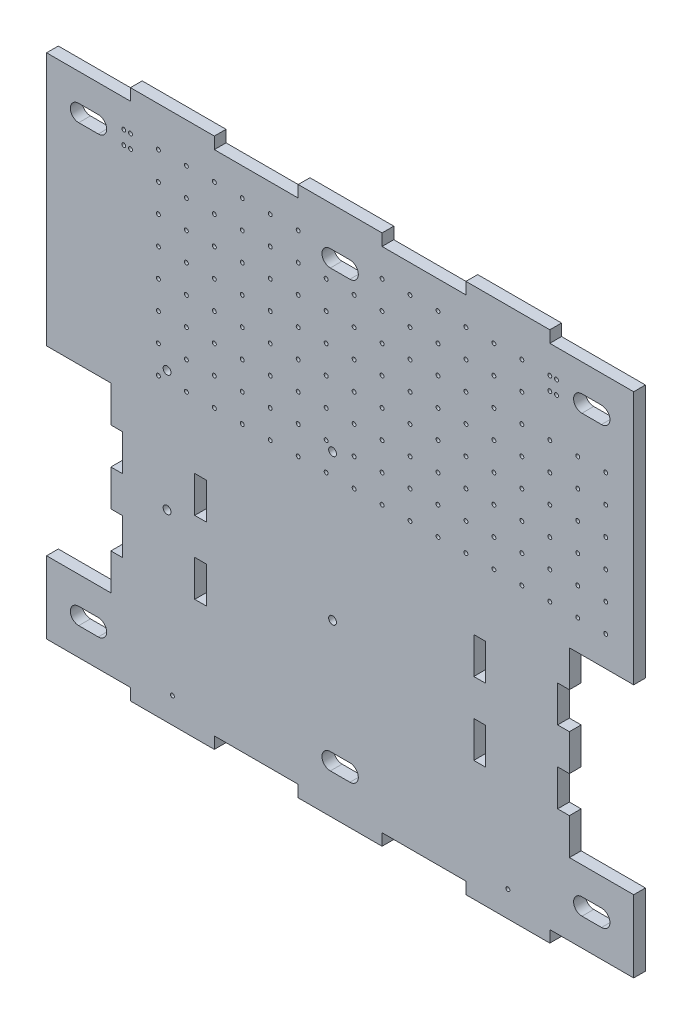
from build123d import *

# Parameters (mm, degrees)
SKETCH1_W           = 266.7
SKETCH1_H           = 241.3
BOSS_EXTRUDE1_DEPTH = 5.334
SKETCH2_W           = 29.21
SKETCH2_H           = 82.55
CUT_EXTRUDE1_DEPTH  = 180.908578328
SKETCH9_W           = 5.334
SKETCH9_H           = 16.51
CUT_EXTRUDE2_DEPTH  = 180.908578328
SKETCH23_W          = 5.334
SKETCH23_H          = 16.51
CUT_EXTRUDE8_DEPTH  = 180.908578328
SKETCH28_W          = 38.1
SKETCH28_H          = 5.334
CUT_EXTRUDE13_DEPTH = 180.908578328
SKETCH29_W          = 38.1
SKETCH29_H          = 5.334
CUT_EXTRUDE14_DEPTH = 180.908578328
SKETCH30_R          = 0.889
CUT_EXTRUDE15_DEPTH = 180.908578328
SKETCH32_R          = 1.778
CUT_EXTRUDE16_DEPTH = 180.908578328
CUT_EXTRUDE19_DEPTH = 180.908578328
SKETCH36_R          = 0.889
CUT_EXTRUDE20_DEPTH = 180.908578328


with BuildPart() as part:
    # Sketch1 → Boss-Extrude1 (new body)
    with BuildSketch(Plane.XY):
        Rectangle(SKETCH1_W, SKETCH1_H)
    extrude(amount=BOSS_EXTRUDE1_DEPTH)

    # Sketch2 → Cut-Extrude1 (cut, through all)
    with BuildSketch(Plane(origin=(0, 0, 0), x_dir=(-1, 0, 0), z_dir=(0, 0, -1))):
        with Locations((118.745, -41.275)):
            Rectangle(SKETCH2_W, SKETCH2_H)
        with Locations((-118.745, -41.275)):
            Rectangle(SKETCH2_W, SKETCH2_H)
    extrude(amount=-CUT_EXTRUDE1_DEPTH, mode=Mode.SUBTRACT)

    # Sketch9 → Cut-Extrude2 (cut, through all)
    with BuildSketch(Plane.XY.offset(5.334)):
        with Locations((-101.473, -24.765)):
            Rectangle(SKETCH9_W, SKETCH9_H)
        with Locations((-101.473, -57.785)):
            Rectangle(SKETCH9_W, SKETCH9_H)
        with Locations((101.473, -57.785)):
            Rectangle(SKETCH9_W, SKETCH9_H)
        with Locations((101.473, -24.765)):
            Rectangle(SKETCH9_W, SKETCH9_H)
    extrude(amount=-CUT_EXTRUDE2_DEPTH, mode=Mode.SUBTRACT)

    # Sketch23 → Cut-Extrude8 (cut, through all)
    with BuildSketch(Plane.XY.offset(5.334)):
        with Locations((-63.373, -57.785)):
            Rectangle(SKETCH23_W, SKETCH23_H)
        with Locations((63.373, -24.765)):
            Rectangle(SKETCH23_W, SKETCH23_H)
        with Locations((63.373, -57.785)):
            Rectangle(SKETCH23_W, SKETCH23_H)
        with Locations((-63.373, -24.765)):
            Rectangle(SKETCH23_W, SKETCH23_H)
    extrude(amount=-CUT_EXTRUDE8_DEPTH, mode=Mode.SUBTRACT)

    # Sketch28 → Cut-Extrude13 (cut, through all)
    with BuildSketch(Plane(origin=(0, 0, 0), x_dir=(-1, 0, 0), z_dir=(0, 0, -1))):
        with Locations((-114.3, -117.983)):
            Rectangle(SKETCH28_W, SKETCH28_H)
        with Locations((-38.1, -117.983)):
            Rectangle(SKETCH28_W, SKETCH28_H)
        with Locations((38.1, -117.983)):
            Rectangle(SKETCH28_W, SKETCH28_H)
        with Locations((114.3, -117.983)):
            Rectangle(SKETCH28_W, SKETCH28_H)
    extrude(amount=-CUT_EXTRUDE13_DEPTH, mode=Mode.SUBTRACT)

    # Sketch29 → Cut-Extrude14 (cut, through all)
    with BuildSketch(Plane(origin=(0, 0, 0), x_dir=(-1, 0, 0), z_dir=(0, 0, -1))):
        with Locations((-114.3, 117.983)):
            Rectangle(SKETCH29_W, SKETCH29_H)
        with Locations((-38.1, 117.983)):
            Rectangle(SKETCH29_W, SKETCH29_H)
        with Locations((38.1, 117.983)):
            Rectangle(SKETCH29_W, SKETCH29_H)
        with Locations((114.3, 117.983)):
            Rectangle(SKETCH29_W, SKETCH29_H)
    extrude(amount=-CUT_EXTRUDE14_DEPTH, mode=Mode.SUBTRACT)

    # Sketch30 → Cut-Extrude15 (cut, through all)
    with BuildSketch(Plane.XY.offset(5.334)):
        with Locations((-98.298, 102.616)):
            Circle(SKETCH30_R)
        with Locations((-98.298, 96.52)):
            Circle(SKETCH30_R)
        with Locations((-95.25, 96.52)):
            Circle(SKETCH30_R)
        with Locations((98.298, 102.616)):
            Circle(SKETCH30_R)
        with Locations((98.298, 96.52)):
            Circle(SKETCH30_R)
        with Locations((95.25, 96.52)):
            Circle(SKETCH30_R)
        with Locations((-44.45, 102.616)):
            Circle(SKETCH30_R)
        with Locations((-31.75, 102.616)):
            Circle(SKETCH30_R)
        with Locations((-19.05, 102.616)):
            Circle(SKETCH30_R)
        with Locations((19.05, 102.616)):
            Circle(SKETCH30_R)
        with Locations((31.75, 102.616)):
            Circle(SKETCH30_R)
        with Locations((44.45, 102.616)):
            Circle(SKETCH30_R)
        with Locations((57.15, 102.616)):
            Circle(SKETCH30_R)
        with Locations((-95.25, 102.616)):
            Circle(SKETCH30_R)
        with Locations((69.85, 102.616)):
            Circle(SKETCH30_R)
        with Locations((82.55, 102.616)):
            Circle(SKETCH30_R)
        with Locations((-31.75, 89.916)):
            Circle(SKETCH30_R)
        with Locations((-19.05, 89.916)):
            Circle(SKETCH30_R)
        with Locations((-6.35, 89.916)):
            Circle(SKETCH30_R)
        with Locations((6.35, 89.916)):
            Circle(SKETCH30_R)
        with Locations((19.05, 89.916)):
            Circle(SKETCH30_R)
        with Locations((31.75, 89.916)):
            Circle(SKETCH30_R)
        with Locations((95.25, 102.616)):
            Circle(SKETCH30_R)
        with Locations((44.45, 89.916)):
            Circle(SKETCH30_R)
        with Locations((57.15, 89.916)):
            Circle(SKETCH30_R)
        with Locations((69.85, 89.916)):
            Circle(SKETCH30_R)
        with Locations((82.55, 89.916)):
            Circle(SKETCH30_R)
        with Locations((-31.75, 77.216)):
            Circle(SKETCH30_R)
        with Locations((-19.05, 77.216)):
            Circle(SKETCH30_R)
        with Locations((-6.35, 77.216)):
            Circle(SKETCH30_R)
        with Locations((6.35, 77.216)):
            Circle(SKETCH30_R)
        with Locations((19.05, 77.216)):
            Circle(SKETCH30_R)
        with Locations((31.75, 77.216)):
            Circle(SKETCH30_R)
        with Locations((44.45, 77.216)):
            Circle(SKETCH30_R)
        with Locations((57.15, 77.216)):
            Circle(SKETCH30_R)
        with Locations((69.85, 77.216)):
            Circle(SKETCH30_R)
        with Locations((82.55, 77.216)):
            Circle(SKETCH30_R)
        with Locations((-31.75, 64.516)):
            Circle(SKETCH30_R)
        with Locations((-19.05, 64.516)):
            Circle(SKETCH30_R)
        with Locations((-6.35, 64.516)):
            Circle(SKETCH30_R)
        with Locations((6.35, 64.516)):
            Circle(SKETCH30_R)
        with Locations((19.05, 64.516)):
            Circle(SKETCH30_R)
        with Locations((31.75, 64.516)):
            Circle(SKETCH30_R)
        with Locations((57.15, 64.516)):
            Circle(SKETCH30_R)
        with Locations((69.85, 64.516)):
            Circle(SKETCH30_R)
        with Locations((82.55, 64.516)):
            Circle(SKETCH30_R)
        with Locations((-31.75, 51.816)):
            Circle(SKETCH30_R)
        with Locations((-19.05, 51.816)):
            Circle(SKETCH30_R)
        with Locations((-6.35, 51.816)):
            Circle(SKETCH30_R)
        with Locations((6.35, 51.816)):
            Circle(SKETCH30_R)
        with Locations((19.05, 51.816)):
            Circle(SKETCH30_R)
        with Locations((31.75, 51.816)):
            Circle(SKETCH30_R)
        with Locations((44.45, 51.816)):
            Circle(SKETCH30_R)
        with Locations((57.15, 51.816)):
            Circle(SKETCH30_R)
        with Locations((69.85, 51.816)):
            Circle(SKETCH30_R)
        with Locations((82.55, 51.816)):
            Circle(SKETCH30_R)
        with Locations((-44.45, 64.516)):
            Circle(SKETCH30_R)
        with Locations((-31.75, 39.116)):
            Circle(SKETCH30_R)
        with Locations((-19.05, 39.116)):
            Circle(SKETCH30_R)
        with Locations((-6.35, 39.116)):
            Circle(SKETCH30_R)
        with Locations((6.35, 39.116)):
            Circle(SKETCH30_R)
        with Locations((19.05, 39.116)):
            Circle(SKETCH30_R)
        with Locations((31.75, 39.116)):
            Circle(SKETCH30_R)
        with Locations((44.45, 64.516)):
            Circle(SKETCH30_R)
        with Locations((44.45, 39.116)):
            Circle(SKETCH30_R)
        with Locations((57.15, 39.116)):
            Circle(SKETCH30_R)
        with Locations((69.85, 39.116)):
            Circle(SKETCH30_R)
        with Locations((82.55, 39.116)):
            Circle(SKETCH30_R)
        with Locations((-44.45, 89.916)):
            Circle(SKETCH30_R)
        with Locations((-44.45, 77.216)):
            Circle(SKETCH30_R)
        with Locations((-44.45, 51.816)):
            Circle(SKETCH30_R)
        with Locations((-44.45, 39.116)):
            Circle(SKETCH30_R)
        with Locations((-57.15, 102.616)):
            Circle(SKETCH30_R)
        with Locations((-69.85, 102.616)):
            Circle(SKETCH30_R)
        with Locations((-82.55, 102.616)):
            Circle(SKETCH30_R)
        with Locations((-57.15, 89.916)):
            Circle(SKETCH30_R)
        with Locations((-69.85, 89.916)):
            Circle(SKETCH30_R)
        with Locations((-82.55, 89.916)):
            Circle(SKETCH30_R)
        with Locations((-57.15, 77.216)):
            Circle(SKETCH30_R)
        with Locations((-69.85, 77.216)):
            Circle(SKETCH30_R)
        with Locations((-82.55, 77.216)):
            Circle(SKETCH30_R)
        with Locations((-57.15, 64.516)):
            Circle(SKETCH30_R)
        with Locations((-69.85, 64.516)):
            Circle(SKETCH30_R)
        with Locations((-82.55, 64.516)):
            Circle(SKETCH30_R)
        with Locations((-57.15, 51.816)):
            Circle(SKETCH30_R)
        with Locations((-69.85, 51.816)):
            Circle(SKETCH30_R)
        with Locations((-82.55, 51.816)):
            Circle(SKETCH30_R)
        with Locations((-57.15, 39.116)):
            Circle(SKETCH30_R)
        with Locations((-69.85, 39.116)):
            Circle(SKETCH30_R)
        with Locations((-82.55, 39.116)):
            Circle(SKETCH30_R)
        with Locations((95.25, 77.216)):
            Circle(SKETCH30_R)
        with Locations((107.95, 77.216)):
            Circle(SKETCH30_R)
        with Locations((120.65, 77.216)):
            Circle(SKETCH30_R)
        with Locations((95.25, 64.516)):
            Circle(SKETCH30_R)
        with Locations((107.95, 64.516)):
            Circle(SKETCH30_R)
        with Locations((120.65, 64.516)):
            Circle(SKETCH30_R)
        with Locations((95.25, 51.816)):
            Circle(SKETCH30_R)
        with Locations((107.95, 51.816)):
            Circle(SKETCH30_R)
        with Locations((120.65, 51.816)):
            Circle(SKETCH30_R)
        with Locations((95.25, 39.116)):
            Circle(SKETCH30_R)
        with Locations((107.95, 39.116)):
            Circle(SKETCH30_R)
        with Locations((120.65, 39.116)):
            Circle(SKETCH30_R)
        with Locations((95.25, 26.416)):
            Circle(SKETCH30_R)
        with Locations((107.95, 26.416)):
            Circle(SKETCH30_R)
        with Locations((120.65, 26.416)):
            Circle(SKETCH30_R)
        with Locations((95.25, 13.716)):
            Circle(SKETCH30_R)
        with Locations((107.95, 13.716)):
            Circle(SKETCH30_R)
        with Locations((120.65, 13.716)):
            Circle(SKETCH30_R)
        with Locations((82.55, 26.416)):
            Circle(SKETCH30_R)
        with Locations((82.55, 13.716)):
            Circle(SKETCH30_R)
        with Locations((69.85, 26.416)):
            Circle(SKETCH30_R)
        with Locations((69.85, 13.716)):
            Circle(SKETCH30_R)
        with Locations((57.15, 26.416)):
            Circle(SKETCH30_R)
        with Locations((57.15, 13.716)):
            Circle(SKETCH30_R)
        with Locations((44.45, 26.416)):
            Circle(SKETCH30_R)
        with Locations((44.45, 13.716)):
            Circle(SKETCH30_R)
        with Locations((31.75, 26.416)):
            Circle(SKETCH30_R)
        with Locations((31.75, 13.716)):
            Circle(SKETCH30_R)
        with Locations((19.05, 26.416)):
            Circle(SKETCH30_R)
        with Locations((19.05, 13.716)):
            Circle(SKETCH30_R)
        with Locations((6.35, 26.416)):
            Circle(SKETCH30_R)
        with Locations((6.35, 13.716)):
            Circle(SKETCH30_R)
        with Locations((-6.35, 26.416)):
            Circle(SKETCH30_R)
        with Locations((-6.35, 13.716)):
            Circle(SKETCH30_R)
        with Locations((-19.05, 26.416)):
            Circle(SKETCH30_R)
        with Locations((-19.05, 13.716)):
            Circle(SKETCH30_R)
        with Locations((-31.75, 26.416)):
            Circle(SKETCH30_R)
        with Locations((-31.75, 13.716)):
            Circle(SKETCH30_R)
        with Locations((-44.45, 26.416)):
            Circle(SKETCH30_R)
        with Locations((-44.45, 13.716)):
            Circle(SKETCH30_R)
        with Locations((-57.15, 26.416)):
            Circle(SKETCH30_R)
        with Locations((-57.15, 13.716)):
            Circle(SKETCH30_R)
        with Locations((-69.85, 26.416)):
            Circle(SKETCH30_R)
        with Locations((-69.85, 13.716)):
            Circle(SKETCH30_R)
        with Locations((-82.55, 26.416)):
            Circle(SKETCH30_R)
        with Locations((-82.55, 13.716)):
            Circle(SKETCH30_R)
    extrude(amount=-CUT_EXTRUDE15_DEPTH, mode=Mode.SUBTRACT)

    # Sketch32 → Cut-Extrude16 (cut, through all)
    with BuildSketch(Plane(origin=(0, 0, 0), x_dir=(-1, 0, 0), z_dir=(0, 0, -1))):
        with Locations((3.430540545, -42.977508744)):
            Circle(SKETCH32_R)
        with Locations((78.614540545, -37.135508744)):
            Circle(SKETCH32_R)
        with Locations((3.430540545, 23.316491256)):
            Circle(SKETCH32_R)
        with Locations((78.614540545, 17.728491256)):
            Circle(SKETCH32_R)
    extrude(amount=-CUT_EXTRUDE16_DEPTH, mode=Mode.SUBTRACT)

    # Sketch35 → Cut-Extrude19 (cut, through all)
    with BuildSketch(Plane.XY.offset(5.334)):
        with BuildLine():
            Line((-109.855, -102.743), (-118.745, -102.743))
            ThreePointArc((-118.745, -102.743), (-122.555, -98.933), (-118.745, -95.123))
            Line((-118.745, -95.123), (-109.855, -95.123))
            ThreePointArc((-109.855, -95.123), (-106.045, -98.933), (-109.855, -102.743))
        make_face()
        with BuildLine():
            Line((109.855, -95.123), (118.745, -95.123))
            ThreePointArc((118.745, -95.123), (122.555, -98.933), (118.745, -102.743))
            Line((118.745, -102.743), (109.855, -102.743))
            ThreePointArc((109.855, -102.743), (106.045, -98.933), (109.855, -95.123))
        make_face()
        with BuildLine():
            Line((109.855, 95.123), (118.745, 95.123))
            ThreePointArc((118.745, 95.123), (122.555, 98.933), (118.745, 102.743))
            Line((118.745, 102.743), (109.855, 102.743))
            ThreePointArc((109.855, 102.743), (106.045, 98.933), (109.855, 95.123))
        make_face()
        with BuildLine():
            Line((-109.855, 102.743), (-118.745, 102.743))
            ThreePointArc((-118.745, 102.743), (-122.555, 98.933), (-118.745, 95.123))
            Line((-118.745, 95.123), (-109.855, 95.123))
            ThreePointArc((-109.855, 95.123), (-106.045, 98.933), (-109.855, 102.743))
        make_face()
        with BuildLine():
            Line((4.445, 102.743), (-4.445, 102.743))
            ThreePointArc((-4.445, 102.743), (-8.255, 98.933), (-4.445, 95.123))
            Line((-4.445, 95.123), (4.445, 95.123))
            ThreePointArc((4.445, 95.123), (8.255, 98.933), (4.445, 102.743))
        make_face()
        with BuildLine():
            Line((4.445, -102.743), (-4.445, -102.743))
            ThreePointArc((-4.445, -102.743), (-8.255, -98.933), (-4.445, -95.123))
            Line((-4.445, -95.123), (4.445, -95.123))
            ThreePointArc((4.445, -95.123), (8.255, -98.933), (4.445, -102.743))
        make_face()
    extrude(amount=-CUT_EXTRUDE19_DEPTH, mode=Mode.SUBTRACT)

    # Sketch36 → Cut-Extrude20 (cut, through all)
    with BuildSketch(Plane(origin=(0, 0, 0), x_dir=(-1, 0, 0), z_dir=(0, 0, -1))):
        with Locations((-76.2, -108.966)):
            Circle(SKETCH36_R)
        with Locations((76.2, -108.966)):
            Circle(SKETCH36_R)
    extrude(amount=-CUT_EXTRUDE20_DEPTH, mode=Mode.SUBTRACT)


solid = part.part
